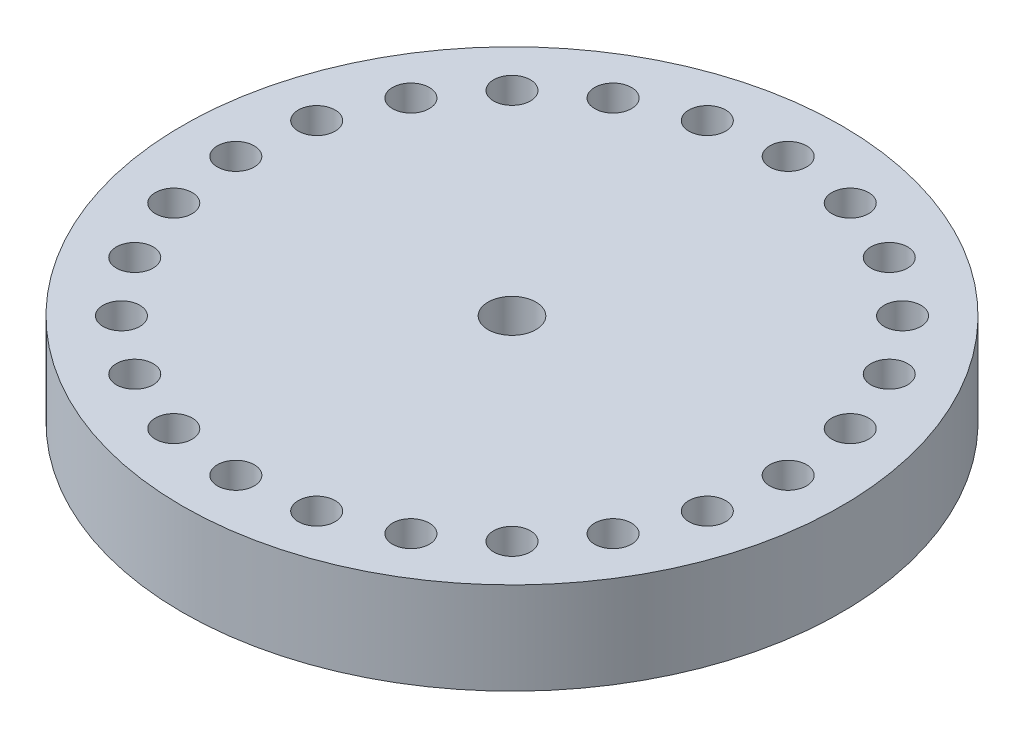
from build123d import *

# Parameters (mm, degrees)
SKETCH1_R                                        = 45.466
BOSS_EXTRUDE1_DEPTH                              = 25.4
SKETCH3_R                                        = 20.32
CUT_EXTRUDE1_DEPTH                               = 12.7
CSK_FOR_1_4_FLAT_HEAD_MACHINE_SCREW1_D           = 6.5278
CSK_FOR_1_4_FLAT_HEAD_MACHINE_SCREW1_DEPTH       = 25.4
CSK_FOR_1_4_FLAT_HEAD_MACHINE_SCREW1_CSINK_D     = 12.8778
CSK_FOR_1_4_FLAT_HEAD_MACHINE_SCREW1_CSINK_ANGLE = 82
CSK_FOR_1_4_FLAT_HEAD_MACHINE_SCREW1_TIP         = 1.961148974
SKETCH8_R                                        = 46.955588052
CUT_EXTRUDE2_DEPTH                               = 12.7
SKETCH4_R                                        = 1.778
CUT_EXTRUDE3_DEPTH                               = 66.540859866
SKETCH9_R                                        = 2.54
CUT_EXTRUDE4_DEPTH                               = 5.08
CIRPATTERN1_COUNT                                = 24
SKETCH10_R                                       = 22.834776664
BOSS_EXTRUDE2_DEPTH                              = 5.08
SKETCH11_R                                       = 3.302
CUT_EXTRUDE5_DEPTH                               = 66.540859866


with BuildPart() as part:
    # Sketch1 → Boss-Extrude1 (new body)
    with BuildSketch(Plane(origin=(0, 0, 0), x_dir=(1, 0, 0), z_dir=(0, 1, 0))):
        Circle(SKETCH1_R)
    extrude(amount=BOSS_EXTRUDE1_DEPTH)

    # Sketch3 → Cut-Extrude1 (cut)
    with BuildSketch(Plane.XZ):
        Circle(SKETCH3_R)
    extrude(amount=-CUT_EXTRUDE1_DEPTH, mode=Mode.SUBTRACT)

    # CSK for 1/4 Flat Head Machine Screw1
    with Locations(Plane(origin=(0, 25.4, 0), x_dir=(1, 0, 0), z_dir=(0, 1, 0))):
        with Locations((0, 0)):
            CounterSinkHole(CSK_FOR_1_4_FLAT_HEAD_MACHINE_SCREW1_D / 2, CSK_FOR_1_4_FLAT_HEAD_MACHINE_SCREW1_CSINK_D / 2, depth=CSK_FOR_1_4_FLAT_HEAD_MACHINE_SCREW1_DEPTH, counter_sink_angle=CSK_FOR_1_4_FLAT_HEAD_MACHINE_SCREW1_CSINK_ANGLE)
            with Locations((0, 0, -(CSK_FOR_1_4_FLAT_HEAD_MACHINE_SCREW1_DEPTH + CSK_FOR_1_4_FLAT_HEAD_MACHINE_SCREW1_TIP / 2))):  # 118° drill point
                Cone(0, CSK_FOR_1_4_FLAT_HEAD_MACHINE_SCREW1_D / 2, CSK_FOR_1_4_FLAT_HEAD_MACHINE_SCREW1_TIP, mode=Mode.SUBTRACT)

    # Sketch8 → Cut-Extrude2 (cut)
    with BuildSketch(Plane(origin=(0, 25.4, 0), x_dir=(1, 0, 0), z_dir=(0, 1, 0))):
        Circle(SKETCH8_R)
    extrude(amount=-CUT_EXTRUDE2_DEPTH, mode=Mode.SUBTRACT)

    # Sketch4 → Cut-Extrude3 (cut, through all)
    with BuildSketch(Plane.XZ):
        with Locations((0, 38.1)):
            Circle(SKETCH4_R)
    cut_extrude3 = extrude(amount=-CUT_EXTRUDE3_DEPTH, mode=Mode.SUBTRACT)

    # Sketch9 → Cut-Extrude4 (cut)
    with BuildSketch(Plane(origin=(0, 12.7, 0), x_dir=(1, 0, 0), z_dir=(0, 1, 0))):
        with Locations((0, -38.1)):
            Circle(SKETCH9_R)
    cut_extrude4 = extrude(amount=-CUT_EXTRUDE4_DEPTH, mode=Mode.SUBTRACT)

    # CirPattern1: Cut-Extrude3, Cut-Extrude4 ×24 about axis
    cirpattern1_axis = Axis((0, 12.7, 0), (0, -1, 0))
    add([cut_extrude3.rotate(cirpattern1_axis, i * 360 / CIRPATTERN1_COUNT) for i in range(1, CIRPATTERN1_COUNT)], mode=Mode.SUBTRACT)
    add([cut_extrude4.rotate(cirpattern1_axis, i * 360 / CIRPATTERN1_COUNT) for i in range(1, CIRPATTERN1_COUNT)], mode=Mode.SUBTRACT)

    # Sketch10 → Boss-Extrude2 (add)
    with BuildSketch(Plane(origin=(0, 12.7, 0), x_dir=(1, 0, 0), z_dir=(0, 1, 0))):
        Circle(SKETCH10_R)
    extrude(amount=-BOSS_EXTRUDE2_DEPTH)

    # Sketch11 → Cut-Extrude5 (cut, through all)
    with BuildSketch(Plane(origin=(0, 12.7, 0), x_dir=(1, 0, 0), z_dir=(0, 1, 0))):
        Circle(SKETCH11_R)
    extrude(amount=-CUT_EXTRUDE5_DEPTH, mode=Mode.SUBTRACT)


solid = part.part
